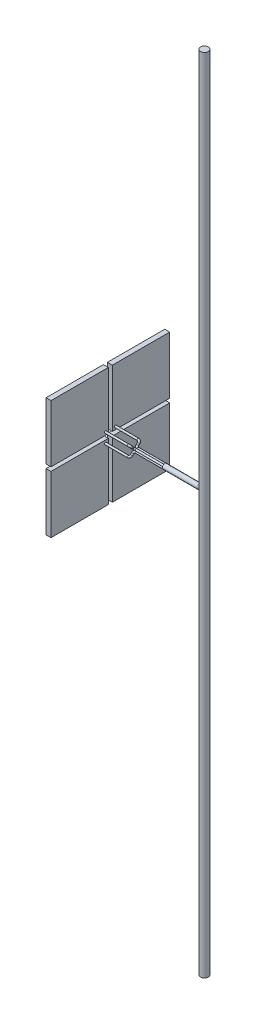
from build123d import *

# Parameters (mm, degrees)
SKETCH_3_W               = 5.8
SKETCH_3_H               = 5.8
EXTRUDE_1_DEPTH          = 0.5
EXTRUDE_1_2_DEPTH        = 0.5
EXTRUDE_1_3_DEPTH        = 0.5
EXTRUDE_1_4_DEPTH        = 0.5
SWEEP_4_PROFILE_R        = 0.1
SWEEP_6_PROFILE_R        = 0.25
SWEEP_8_PROFILE_R        = 0.4
MOVE_BODY_3_OUTLINE_R    = 0.1
MOVE_BODY_3_ANGLE        = 90
MOVE_BODY_3_2_OUTLINE_R  = 0.1
MOVE_BODY_3_2_ANGLE      = 90
MOVE_BODY_3_3_OUTLINE_R  = 0.1
MOVE_BODY_3_3_DEPTH      = 2.8000001
MOVE_START               = 0.341421256
MOVE_BODY_3_4_OUTLINE_R  = 0.1
MOVE_BODY_3_4_DEPTH      = 0.165685625
MOVE_START_2             = 3.1999999
MOVE_BODY_3_5_OUTLINE_R  = 0.1
MOVE_BODY_3_5_DEPTH      = 2.8000001
MOVE_BODY_3_6_OUTLINE_R  = 0.1
MOVE_BODY_3_6_ANGLE      = 90
MOVE_BODY_3_7_OUTLINE_R  = 0.1
MOVE_BODY_3_7_ANGLE      = 90
MOVE_BODY_3_8_OUTLINE_R  = 0.1
MOVE_BODY_3_8_DEPTH      = 2.8000001
MOVE_BODY_3_9_OUTLINE_R  = 0.1
MOVE_BODY_3_9_DEPTH      = 0.165685625
MOVE_BODY_3_10_OUTLINE_R = 0.1
MOVE_BODY_3_10_DEPTH     = 2.8000001
MOVE_BODY_3_11_OUTLINE_R = 0.1
MOVE_BODY_3_11_ANGLE     = 90
MOVE_BODY_3_12_OUTLINE_R = 0.1
MOVE_BODY_3_12_ANGLE     = 90
MOVE_BODY_3_13_OUTLINE_R = 0.1
MOVE_BODY_3_13_DEPTH     = 2.8000001
MOVE_START_3             = -0.507106881
MOVE_BODY_3_14_OUTLINE_R = 0.1
MOVE_BODY_3_14_DEPTH     = 0.165685625
MOVE_BODY_3_15_OUTLINE_R = 0.1
MOVE_BODY_3_15_DEPTH     = 2.8000001


with BuildPart() as part:
    # 草图3 → 凸台-拉伸1 (new body)
    with BuildSketch(Plane(origin=(0, 0, 0), x_dir=(0, 0, -1), z_dir=(1, 0, 0))):
        with Locations((3.1, 3.1)):
            Rectangle(SKETCH_3_W, SKETCH_3_H)
    extrude(amount=EXTRUDE_1_DEPTH)


with BuildPart() as body_2:
    # 草图3 → Extrude 1 2 (new body)
    with BuildSketch(Plane(origin=(0, 0, 0), x_dir=(0, 0, -1), z_dir=(1, 0, 0))):
        with Locations((-3.1, -3.1)):
            Rectangle(SKETCH_3_W, SKETCH_3_H)
    extrude(amount=EXTRUDE_1_2_DEPTH)


with BuildPart() as body_3:
    # 草图3 → Extrude 1 3 (new body)
    with BuildSketch(Plane(origin=(0, 0, 0), x_dir=(0, 0, -1), z_dir=(1, 0, 0))):
        with Locations((3.1, -3.1)):
            Rectangle(SKETCH_3_W, SKETCH_3_H)
    extrude(amount=EXTRUDE_1_3_DEPTH)


with BuildPart() as body_4:
    # 草图3 → Extrude 1 4 (new body)
    with BuildSketch(Plane(origin=(0, 0, 0), x_dir=(0, 0, -1), z_dir=(1, 0, 0))):
        with Locations((-3.1, 3.1)):
            Rectangle(SKETCH_3_W, SKETCH_3_H)
    extrude(amount=EXTRUDE_1_4_DEPTH)


with BuildPart() as body_5:
    # 扫描4: sweep along a curve in space
    with BuildLine() as sweep_4_path:
        Line((0, -0.5, 0.5), (2.8, -0.5, 0.5))
        ThreePointArc((2.8, -0.5, 0.5), (2.941421356, -0.458578644, 0.458578644), (3, -0.358578644, 0.358578644))
        Line((3, -0.241421356, 0.241421356), (3, -0.358578644, 0.358578644))
        ThreePointArc((3.2, -0.1, 0.1), (3.058578644, -0.141421356, 0.141421356), (3, -0.241421356, 0.241421356))
        Line((3.2, -0.1, 0.1), (6, -0.1, 0.1))
    # 扫描4 profile (on start of the path) → 扫描4 (sweep)
    with BuildSketch(Plane(origin=(0, -0.5, 0.5), x_dir=(0, 0, 1), z_dir=(1, 0, 0))):
        Circle(SWEEP_4_PROFILE_R)
    sweep(path=sweep_4_path.line)


with BuildPart() as body_6:
    # 扫描6: sweep along a path in 草图31
    with BuildLine(Plane.XY) as sweep_6_path:
        Line((10, 5.5), (10, 0.5))
        ThreePointArc((10, 0.5), (9.85355336, 0.146446579), (9.499999914, 0))
        Line((9.499999914, 0), (6.001497631, 6.02e-07))
    # 扫描6 profile (on start of the path) → 扫描6 (sweep)
    with BuildSketch(Plane(origin=(10, 5.5, 0), x_dir=(0, 0, -1), z_dir=(0, -1, 0))):
        Circle(SWEEP_6_PROFILE_R)
    sweep(path=sweep_6_path.line)


with BuildPart() as body_7:
    # 扫描8: sweep along a path in 草图39
    with BuildLine(Plane.XY) as sweep_8_path:
        Line((10, -42.5), (10, 38.5))
    # 扫描8 profile (on start of the path) → 扫描8 (sweep)
    with BuildSketch(Plane(origin=(10, -42.5, 0), x_dir=(0, 0, 1), z_dir=(0, 1, 0))):
        Circle(SWEEP_8_PROFILE_R)
    sweep(path=sweep_8_path.line)


with BuildPart() as body_8:
    # Move Body 3: read off the stored shape, not the designer's step
    # Move Body 3 outline → Move Body 3 (revolve)
    with BuildSketch(Plane(origin=(2.8, 0.358578644, 0.358578644), x_dir=(0, 0.7071067811865401, 0.7071067811865551), z_dir=(-1, 0, 0))):
        with Locations((0.2, 0)):
            Circle(MOVE_BODY_3_OUTLINE_R)
    revolve(axis=Axis((2.8, 0.358578644, 0.358578644), (0, 0.7071067811865555, -0.7071067811865405)), revolution_arc=MOVE_BODY_3_ANGLE)

    # Move Body 3 2 outline → Move Body 3 2 (revolve)
    with BuildSketch(Plane(origin=(3.2, 0.241421356, 0.241421356), x_dir=(1.3934999695075554e-15, -0.7071067811865401, -0.7071067811865551), z_dir=(1, 0, 0))):
        with Locations((0.2, 0)):
            Circle(MOVE_BODY_3_2_OUTLINE_R)
    revolve(axis=Axis((3.2, 0.241421356, 0.241421356), (0, 0.7071067811865555, -0.7071067811865405)), revolution_arc=MOVE_BODY_3_2_ANGLE)

    # Move Body 3 3 outline → Move Body 3 3 (add)
    with BuildSketch(Plane.YZ):
        with Locations((0.5, 0.5)):
            Circle(MOVE_BODY_3_3_OUTLINE_R)
    extrude(amount=MOVE_BODY_3_3_DEPTH)

    # Move Body 3 4 outline → Move Body 3 4 (add)
    with BuildSketch(Plane(origin=(0, 0, 0), x_dir=(1, 0, 0), z_dir=(0, 0.70710678118654, 0.707106781186555)).offset(MOVE_START)):
        with Locations((3, 0)):
            Circle(MOVE_BODY_3_4_OUTLINE_R)
    extrude(amount=MOVE_BODY_3_4_DEPTH)

    # Move Body 3 5 outline → Move Body 3 5 (add)
    with BuildSketch(Plane.YZ.offset(MOVE_START_2)):
        with Locations((0.1, 0.1)):
            Circle(MOVE_BODY_3_5_OUTLINE_R)
    extrude(amount=MOVE_BODY_3_5_DEPTH)


with BuildPart() as body_9:
    # Move Body 3 6 outline → Move Body 3 6 (revolve)
    with BuildSketch(Plane(origin=(2.8, 0.358578644, -0.358578644), x_dir=(1, 0, 0), z_dir=(0, -0.707106781186552, 0.707106781186543))):
        with Locations((0.2, 0)):
            Circle(MOVE_BODY_3_6_OUTLINE_R)
    revolve(axis=Axis((2.8, 0.358578644, -0.358578644), (0, 0.707106781186543, 0.707106781186552)), revolution_arc=MOVE_BODY_3_6_ANGLE)

    # Move Body 3 7 outline → Move Body 3 7 (revolve)
    with BuildSketch(Plane(origin=(3.2, 0.241421356, -0.241421356), x_dir=(-1, 0, 0), z_dir=(-1.0106430996148604e-15, 0.707106781186552, -0.707106781186543))):
        with Locations((0.2, 0)):
            Circle(MOVE_BODY_3_7_OUTLINE_R)
    revolve(axis=Axis((3.2, 0.241421356, -0.241421356), (0, 0.707106781186543, 0.707106781186552)), revolution_arc=MOVE_BODY_3_7_ANGLE)

    # Move Body 3 8 outline → Move Body 3 8 (add)
    with BuildSketch(Plane.YZ):
        with Locations((0.5, -0.5)):
            Circle(MOVE_BODY_3_8_OUTLINE_R)
    extrude(amount=MOVE_BODY_3_8_DEPTH)

    # Move Body 3 9 outline → Move Body 3 9 (add)
    with BuildSketch(Plane(origin=(0, 0, 0), x_dir=(1, 0, 0), z_dir=(0, 0.707106781186552, -0.707106781186543)).offset(MOVE_START)):
        with Locations((3, 0)):
            Circle(MOVE_BODY_3_9_OUTLINE_R)
    extrude(amount=MOVE_BODY_3_9_DEPTH)

    # Move Body 3 10 outline → Move Body 3 10 (add)
    with BuildSketch(Plane.YZ.offset(MOVE_START_2)):
        with Locations((0.1, -0.1)):
            Circle(MOVE_BODY_3_10_OUTLINE_R)
    extrude(amount=MOVE_BODY_3_10_DEPTH)


with BuildPart() as body_10:
    # Move Body 3 11 outline → Move Body 3 11 (revolve)
    with BuildSketch(Plane(origin=(2.8, -0.358578644, -0.358578644), x_dir=(1, 0, 0), z_dir=(0, 0.707106781186545, 0.70710678118655))):
        with Locations((0.2, 0)):
            Circle(MOVE_BODY_3_11_OUTLINE_R)
    revolve(axis=Axis((2.8, -0.358578644, -0.358578644), (0, 0.70710678118655, -0.707106781186545)), revolution_arc=MOVE_BODY_3_11_ANGLE)

    # Move Body 3 12 outline → Move Body 3 12 (revolve)
    with BuildSketch(Plane(origin=(3.2, -0.241421356, -0.241421356), x_dir=(-1, 0, 0), z_dir=(-1.0106430996148606e-15, -0.707106781186545, -0.70710678118655))):
        with Locations((0.2, 0)):
            Circle(MOVE_BODY_3_12_OUTLINE_R)
    revolve(axis=Axis((3.2, -0.241421356, -0.241421356), (0, 0.70710678118655, -0.707106781186545)), revolution_arc=MOVE_BODY_3_12_ANGLE)

    # Move Body 3 13 outline → Move Body 3 13 (add)
    with BuildSketch(Plane.YZ):
        with Locations((-0.5, -0.5)):
            Circle(MOVE_BODY_3_13_OUTLINE_R)
    extrude(amount=MOVE_BODY_3_13_DEPTH)

    # Move Body 3 14 outline → Move Body 3 14 (add)
    with BuildSketch(Plane(origin=(0, 0, 0), x_dir=(1, 0, 0), z_dir=(0, 0.707106781186545, 0.70710678118655)).offset(MOVE_START_3)):
        with Locations((3, 0)):
            Circle(MOVE_BODY_3_14_OUTLINE_R)
    extrude(amount=MOVE_BODY_3_14_DEPTH)

    # Move Body 3 15 outline → Move Body 3 15 (add)
    with BuildSketch(Plane.YZ.offset(MOVE_START_2)):
        with Locations((-0.1, -0.1)):
            Circle(MOVE_BODY_3_15_OUTLINE_R)
    extrude(amount=MOVE_BODY_3_15_DEPTH)


solid = Compound([part.part, body_2.part, body_3.part, body_4.part, body_5.part, body_6.part, body_7.part, body_8.part, body_9.part, body_10.part])
